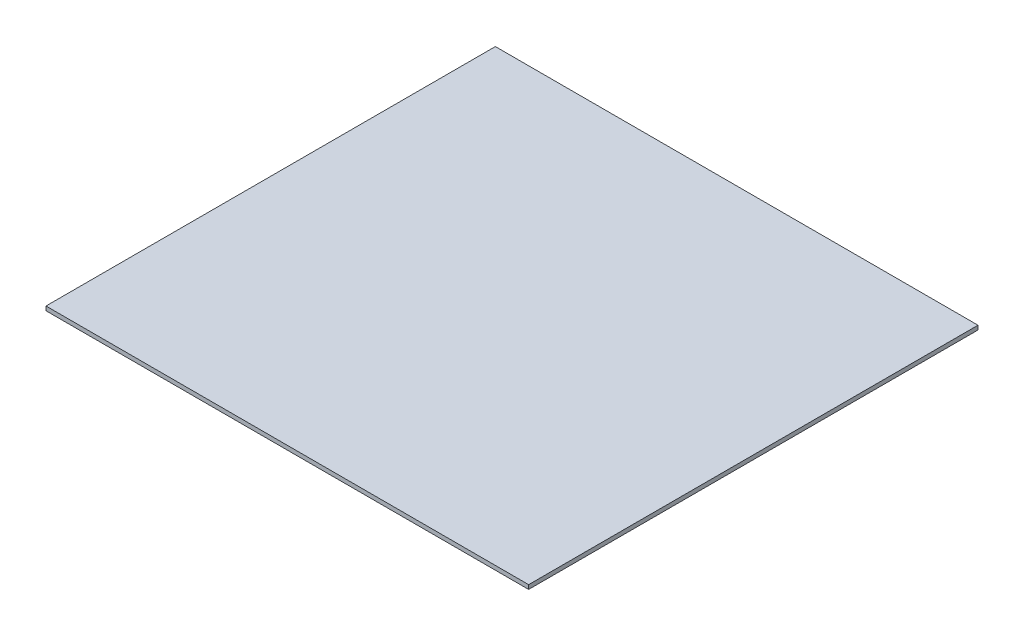
from build123d import *

# Parameters (mm, degrees)
SKETCH1_W           = 368.3
SKETCH1_H           = 342.9
BOSS_EXTRUDE1_DEPTH = 3.175


with BuildPart() as part:
    # Sketch1 → Boss-Extrude1 (new body)
    with BuildSketch(Plane(origin=(0, 0, 0), x_dir=(1, 0, 0), z_dir=(0, 1, 0))):
        Rectangle(SKETCH1_W, SKETCH1_H)
    extrude(amount=BOSS_EXTRUDE1_DEPTH)


solid = part.part
